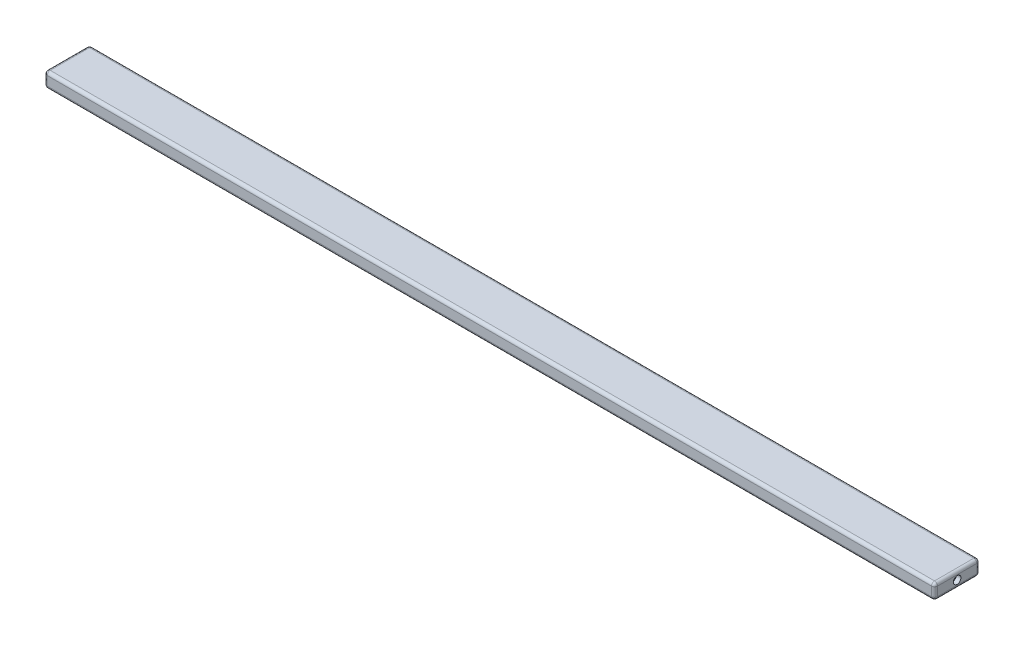
from build123d import *

# Parameters (mm, degrees)
SKETCH1_W           = 590
SKETCH1_H           = 10
BOSS_EXTRUDE1_DEPTH = 30
FILLET1_R           = 2
FILLET2_R           = 2
SKETCH5_R           = 2.5
CUT_EXTRUDE7_DEPTH  = 3
SKETCH6_R           = 2.5
CUT_EXTRUDE8_DEPTH  = 3


with BuildPart() as part:
    # Sketch1 → Boss-Extrude1 (new body)
    with BuildSketch(Plane.XY):
        with Locations((0, 5)):
            Rectangle(SKETCH1_W, SKETCH1_H)
    extrude(amount=BOSS_EXTRUDE1_DEPTH)

    # Fillet1
    fillet1_edges = [part.edges().sort_by_distance(p)[0] for p in [
        (0, 10, 30),
        (-295, 5, 30),
        (0, 10, 0),
        (295, 5, 0),
        (0, 0, 0),
        (-295, 5, 0),
        (-295, 10, 15),
        (295, 10, 15),
        (295, 0, 15),
        (-295, 0, 15),
        (0, 0, 30),
    ]]
    fillet(fillet1_edges, radius=FILLET1_R)

    # Fillet2
    # the kernel refuses this fillet: 2 mm, written as the material it takes off along each edge
    with BuildSketch(Plane(origin=(293, 8, 28), x_dir=(0, 0, 1), z_dir=(1, 0, 0))) as fillet2_piece_1_section:
        Polygon((0, 0), (FILLET2_R, 0), (FILLET2_R, -FILLET2_R), (0, -FILLET2_R), align=None)
    fillet2_piece_1 = extrude(amount=FILLET2_R, mode=Mode.PRIVATE)
    fillet2_piece_1 = fillet2_piece_1 - Plane(origin=(293, 8, 28), x_dir=(0, -0.7071067811865475, -0.7071067811865475), z_dir=(1, 0, 0)) * Sphere(FILLET2_R, mode=Mode.PRIVATE)
    add(fillet2_piece_1, mode=Mode.SUBTRACT)
    with BuildSketch(Plane(origin=(293, 2, 28), x_dir=(0, 0, 1), z_dir=(1, 0, 0))) as fillet2_piece_2_section:
        Polygon((0, 0), (FILLET2_R, 0), (FILLET2_R, FILLET2_R), (0, FILLET2_R), align=None)
    fillet2_piece_2 = extrude(amount=FILLET2_R, mode=Mode.PRIVATE)
    fillet2_piece_2 = fillet2_piece_2 - Plane(origin=(293, 2, 28), x_dir=(0, 0.7071067811865475, -0.7071067811865475), z_dir=(1, 0, 0)) * Sphere(FILLET2_R, mode=Mode.PRIVATE)
    add(fillet2_piece_2, mode=Mode.SUBTRACT)
    with BuildSketch(Plane(origin=(295, 2, 30), x_dir=(0, 0, -1), z_dir=(0, 1, 0))) as fillet2_piece_3:
        with BuildLine():
            CenterArc((FILLET2_R, FILLET2_R), FILLET2_R, 180, 90)
            Line((0, FILLET2_R), (0, 0))
            Line((0, 0), (FILLET2_R, 0))
        make_face()
    extrude(amount=6, mode=Mode.SUBTRACT)

    # Sketch5 → Cut-Extrude7 (cut)
    with BuildSketch(Plane.ZY.offset(295)):
        with Locations((10, 5)):
            Circle(SKETCH5_R)
    extrude(amount=-CUT_EXTRUDE7_DEPTH, mode=Mode.SUBTRACT)

    # Sketch6 → Cut-Extrude8 (cut)
    with BuildSketch(Plane(origin=(295, 0, 0), x_dir=(0, 0, -1), z_dir=(1, 0, 0))):
        with Locations((-15, 5)):
            Circle(SKETCH6_R)
    extrude(amount=-CUT_EXTRUDE8_DEPTH, mode=Mode.SUBTRACT)


solid = part.part
